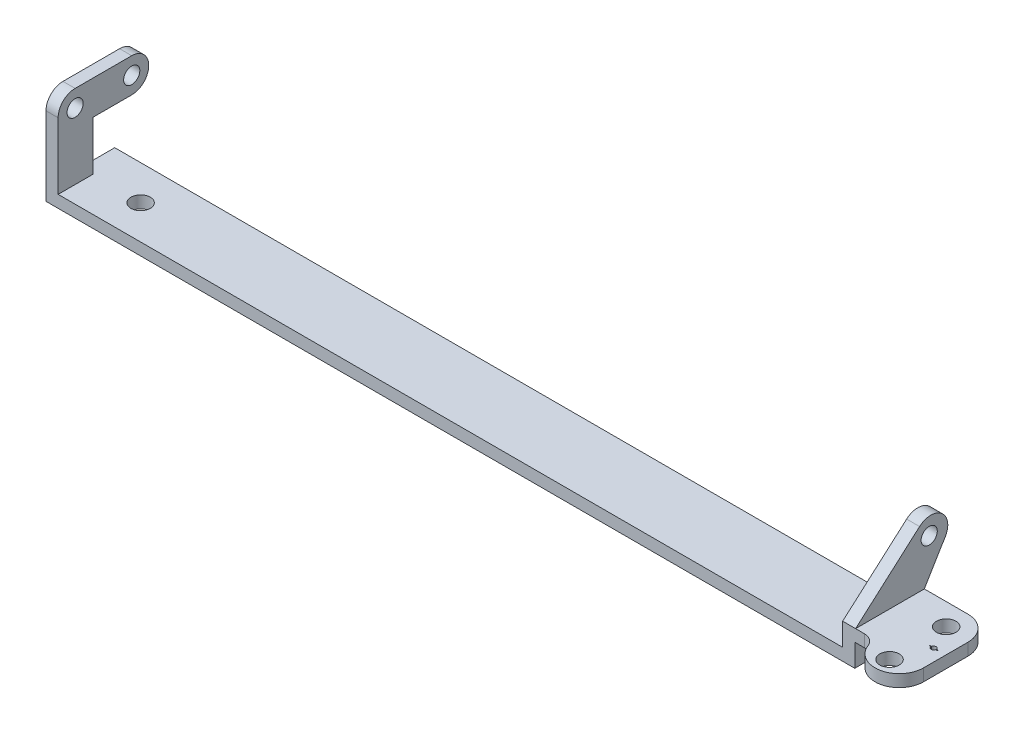
from build123d import *

# Parameters (mm, degrees)
EXTRUDE_THIN1_DEPTH = 85
BOSS_EXTRUDE1_DEPTH = 15
BOSS_EXTRUDE2_DEPTH = 16
FILLET1_R           = 21
BOSS_EXTRUDE3_DEPTH = 15
FILLET2_R           = 16
SKETCH6_R           = 12
CUT_EXTRUDE2_DEPTH  = 1094.547438386
FILLET3_R           = 30
SKETCH7_R           = 12
CUT_EXTRUDE3_DEPTH  = 1096.823890961
SKETCH9_R           = 10
CUT_EXTRUDE4_DEPTH  = 1098.335409071
CUT_EXTRUDE5_DEPTH  = 1094.547438386


with BuildPart() as part:
    # Sketch1 → Extrude-Thin1 (new body)
    with BuildSketch(Plane.XY):
        Polygon((0, 0), (1000, 0), (1000, 28), (1085, 28), (1085, 43), (985, 43), (985, 15), (0, 15), align=None)
    extrude(amount=-EXTRUDE_THIN1_DEPTH)

    # Sketch2 → Boss-Extrude1 (add)
    with BuildSketch(Plane.ZY):
        Polygon((0, 15), (0, 118), (-112, 118), (-112, 76), (-43, 76), (-43, 15), align=None)
    extrude(amount=-BOSS_EXTRUDE1_DEPTH)

    # Sketch3 → Boss-Extrude2 (add)
    with BuildSketch(Plane.ZY.offset(-985)):
        with BuildLine():
            Line((0, 43), (-79.111854281, 112.751806515))
            ThreePointArc((-79.111854281, 112.751806515), (-106.449245092, 113.128168106), (-110.990788091, 86.168031394))
            Line((-110.990788091, 86.168031394), (-85, 43))
            Line((-85, 43), (0, 43))
        make_face()
    extrude(amount=-BOSS_EXTRUDE2_DEPTH)

    # Fillet1
    fillet1_edges = [part.edges().sort_by_distance(p)[0] for p in [
        (7.5, 76, -112),
        (7.5, 118, -112),
        (7.5, 118, 0),
    ]]
    fillet(fillet1_edges, radius=FILLET1_R - 0.0001)  # a hair under: the kernel refuses the full size

    # Sketch5 → Boss-Extrude3 (add)
    with BuildSketch(Plane(origin=(0, 43, 0), x_dir=(1, 0, 0), z_dir=(0, 1, 0))):
        with BuildLine():
            Line((1025, 0), (1085, 0))
            ThreePointArc((1085, 0), (1055, -30), (1025, 0))
        make_face()
    extrude(amount=-BOSS_EXTRUDE3_DEPTH)

    # Fillet2
    fillet2_edges = [part.edges().sort_by_distance(p)[0] for p in [
        (1025, 35.5, 0),
    ]]
    fillet(fillet2_edges, radius=FILLET2_R)

    # Sketch6 → Cut-Extrude2 (cut, through all)
    with BuildSketch(Plane(origin=(0, 43, 0), x_dir=(1, 0, 0), z_dir=(0, 1, 0))):
        with Locations(Location((1055, -12, 0), (0, 0, 270))):
            Circle(SKETCH6_R)
        with Locations(Location((1055, 58, 0), (0, 0, 270))):
            Circle(SKETCH6_R)
    extrude(amount=-CUT_EXTRUDE2_DEPTH, mode=Mode.SUBTRACT)

    # Fillet3
    fillet3_edges = [part.edges().sort_by_distance(p)[0] for p in [
        (1085, 35.5, -85),
    ]]
    fillet(fillet3_edges, radius=FILLET3_R)

    # Sketch7 → Cut-Extrude3 (cut, through all)
    with BuildSketch(Plane(origin=(0, 15, 0), x_dir=(1, 0, 0), z_dir=(0, 1, 0))):
        with Locations(Location((75, 42, 0), (0, 0, 270))):
            Circle(SKETCH7_R)
    extrude(amount=-CUT_EXTRUDE3_DEPTH, mode=Mode.SUBTRACT)

    # Sketch9 → Cut-Extrude4 (cut, through all)
    with BuildSketch(Plane.ZY):
        with Locations((-91, 97)):
            Circle(SKETCH9_R)
        with Locations((-21, 97)):
            Circle(SKETCH9_R)
    extrude(amount=-CUT_EXTRUDE4_DEPTH, mode=Mode.SUBTRACT)

    # Sketch10 → Cut-Extrude5 (cut, through all)
    with BuildSketch(Plane(origin=(0, 43, 0), x_dir=(1, 0, 0), z_dir=(0, 1, 0))):
        with BuildLine():
            Line((1067.041960108, 28), (1072.958039892, 28))
            ThreePointArc((1072.958039892, 28), (1070, 30.5), (1067.041960108, 28))
        make_face()
        with BuildLine():
            ThreePointArc((1067.041960108, 27), (1070, 24.5), (1072.958039892, 27))
            Line((1072.958039892, 27), (1067.041960108, 27))
        make_face()
        with BuildLine():
            Line((1075, 27), (1075, 28))
            Line((1075, 28), (1072.958039892, 28))
            ThreePointArc((1072.958039892, 28), (1072.989491568, 27.750878781), (1073, 27.5))
            ThreePointArc((1073, 27.5), (1072.989491568, 27.249121219), (1072.958039892, 27))
            Line((1072.958039892, 27), (1075, 27))
        make_face()
        with BuildLine():
            ThreePointArc((1067.041960108, 27), (1067, 27.5), (1067.041960108, 28))
            Line((1067.041960108, 28), (1065, 28))
            Line((1065, 28), (1065, 27))
            Line((1065, 27), (1067.041960108, 27))
        make_face()
        with BuildLine():
            ThreePointArc((1073, 27.5), (1072.989491568, 27.750878781), (1072.958039892, 28))
            Line((1072.958039892, 28), (1067.041960108, 28))
            ThreePointArc((1067.041960108, 28), (1067, 27.5), (1067.041960108, 27))
            Line((1067.041960108, 27), (1072.958039892, 27))
            ThreePointArc((1072.958039892, 27), (1072.989491568, 27.249121219), (1073, 27.5))
        make_face()
    extrude(amount=-CUT_EXTRUDE5_DEPTH, mode=Mode.SUBTRACT)


solid = part.part
